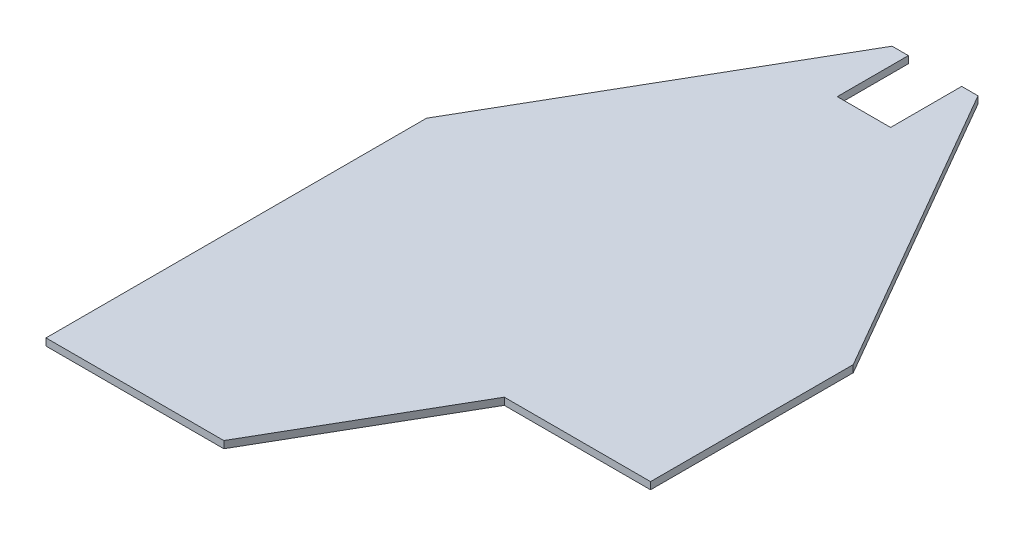
from build123d import *

# Parameters (mm, degrees)
BOSS_EXTRUDE2_DEPTH = 20


with BuildPart() as part:
    # Sketch1 → Boss-Extrude2 (new body)
    with BuildSketch(Plane(origin=(0, 0, 0), x_dir=(1, 0, 0), z_dir=(0, 1, 0))):
        Polygon((600, 0), (188.675134595, 0), (-100, -500), (-600, -500), (-600, 0), (-600, 570), (-120.799276573, 1400), (-75, 1400), (-75, 1200), (75, 1200), (75, 1400), (120.799276573, 1400), (600, 570), align=None)
    extrude(amount=BOSS_EXTRUDE2_DEPTH)


solid = part.part
